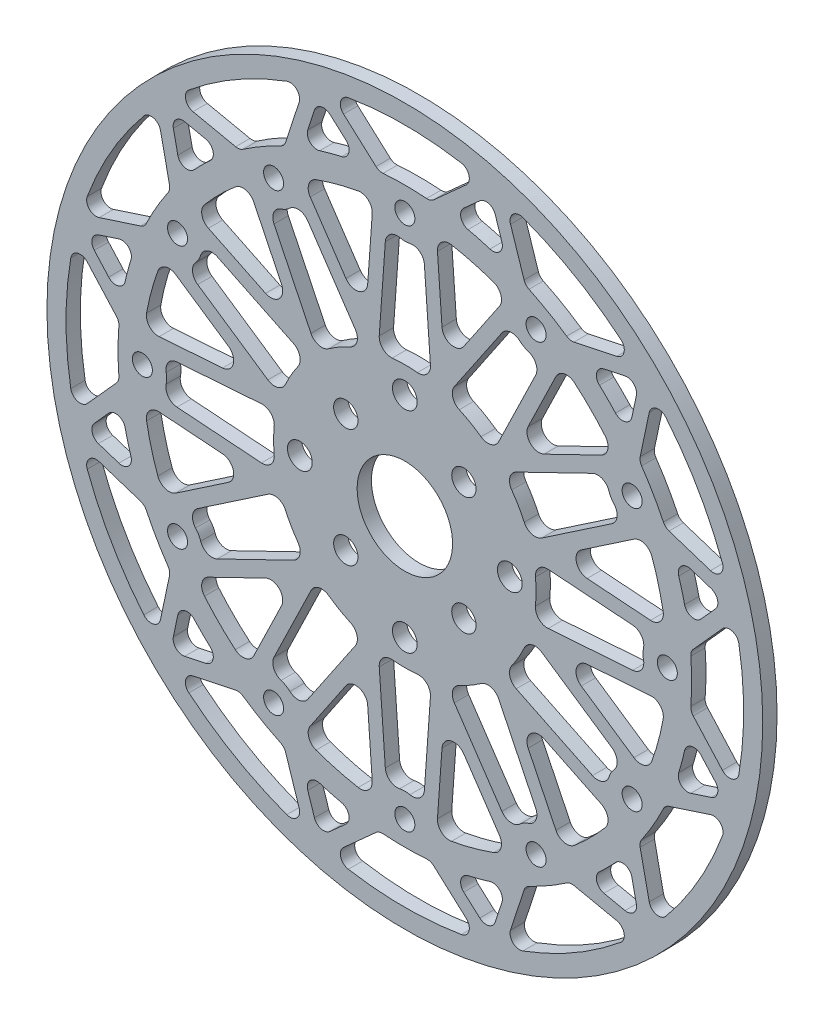
from build123d import *

# Parameters (mm, degrees)
SKETCH_1_R          = 75
EXTRUDE_1_DEPTH     = 3
SKETCH_2_R          = 2.1
SKETCH_2_R_2        = 2.6
SKETCH_2_R_3        = 2.55
SKETCH_2_R_4        = 10
CUT_EXTRUDE_1_DEPTH = 3
SKETCH_3_R          = 27.5
CUT_EXTRUDE_2_DEPTH = 10
EXTRUDE_1_2_DEPTH   = 3
FILLET_1_R          = 2.5
SKETCH_5_R          = 71
CUT_EXTRUDE_3_DEPTH = 3
EXTRUDE_3_DEPTH     = 3
FILLET_2_R          = 2


with BuildPart() as part:
    # 草图1 → Extrude 1 (new body)
    with BuildSketch(Plane.XY):
        Circle(SKETCH_1_R)
    extrude(amount=EXTRUDE_1_DEPTH)

    # 草图2 → 切除-拉伸1 (cut)
    with BuildSketch(Plane(origin=(0, 0, 0), x_dir=(-1, 0, 0), z_dir=(0, 0, -1))):
        with Locations((0, 55)):
            Circle(SKETCH_2_R)
        with Locations((27.5, 47.631397208)):
            Circle(SKETCH_2_R)
        with Locations((47.631397208, 27.5)):
            Circle(SKETCH_2_R)
        with Locations((55, 0)):
            Circle(SKETCH_2_R)
        with Locations((47.631397208, -27.5)):
            Circle(SKETCH_2_R)
        with Locations((27.5, -47.631397208)):
            Circle(SKETCH_2_R)
        with Locations((0, -55)):
            Circle(SKETCH_2_R)
        with Locations((-27.5, -47.631397208)):
            Circle(SKETCH_2_R)
        with Locations((-47.631397208, -27.5)):
            Circle(SKETCH_2_R)
        with Locations((-55, 0)):
            Circle(SKETCH_2_R)
        with Locations((-47.631397208, 27.5)):
            Circle(SKETCH_2_R)
        with Locations((-27.5, 47.631397208)):
            Circle(SKETCH_2_R)
        with Locations((0, 22)):
            Circle(SKETCH_2_R_2)
        with Locations((12.374368671, 12.374368671)):
            Circle(SKETCH_2_R_3)
        with Locations((22, 0)):
            Circle(SKETCH_2_R_2)
        with Locations((12.374368671, -12.374368671)):
            Circle(SKETCH_2_R_3)
        with Locations((0, -22)):
            Circle(SKETCH_2_R_2)
        with Locations((-12.374368671, -12.374368671)):
            Circle(SKETCH_2_R_3)
        with Locations((-22, 0)):
            Circle(SKETCH_2_R_2)
        with Locations((-12.374368671, 12.374368671)):
            Circle(SKETCH_2_R_3)
        Circle(SKETCH_2_R_4)
    extrude(amount=-CUT_EXTRUDE_1_DEPTH, mode=Mode.SUBTRACT)

    # 草图3 → 切除-拉伸2 (cut)
    with BuildSketch(Plane.XY.offset(3)):
        with BuildLine():
            ThreePointArc((5.094515605, 54.763545455), (0, 49.9), (-5.094515605, 54.763545455))
            ThreePointArc((-5.094515605, 54.763545455), (-14.235047481, 53.125920446), (-22.969792794, 49.973879367))
            ThreePointArc((-22.969792794, 49.973879367), (-24.95, 43.214667649), (-31.793752661, 44.879363763))
            ThreePointArc((-31.793752661, 44.879363763), (-38.890872965, 38.890872965), (-44.879363763, 31.793752661))
            ThreePointArc((-44.879363763, 31.793752661), (-43.214667649, 24.95), (-49.973879367, 22.969792794))
            ThreePointArc((-49.973879367, 22.969792794), (-53.125920446, 14.235047481), (-54.763545455, 5.094515605))
            ThreePointArc((-54.763545455, 5.094515605), (-49.9, 0), (-54.763545455, -5.094515605))
            ThreePointArc((-54.763545455, -5.094515605), (-53.125920446, -14.235047481), (-49.973879367, -22.969792794))
            ThreePointArc((-49.973879367, -22.969792794), (-43.214667649, -24.95), (-44.879363763, -31.793752661))
            ThreePointArc((-44.879363763, -31.793752661), (-38.890872965, -38.890872965), (-31.793752661, -44.879363763))
            ThreePointArc((-31.793752661, -44.879363763), (-24.95, -43.214667649), (-22.969792794, -49.973879367))
            ThreePointArc((-22.969792794, -49.973879367), (-14.235047481, -53.125920446), (-5.094515605, -54.763545455))
            ThreePointArc((-5.094515605, -54.763545455), (0, -49.9), (5.094515605, -54.763545455))
            ThreePointArc((5.094515605, -54.763545455), (14.235047481, -53.125920446), (22.969792793, -49.973879367))
            ThreePointArc((22.969792793, -49.973879367), (24.95, -43.214667649), (31.793752661, -44.879363763))
            ThreePointArc((31.793752661, -44.879363763), (38.890872965, -38.890872965), (44.879363763, -31.793752661))
            ThreePointArc((44.879363763, -31.793752661), (43.214667649, -24.95), (49.973879367, -22.969792794))
            ThreePointArc((49.973879367, -22.969792794), (53.125920446, -14.235047481), (54.763545455, -5.094515605))
            ThreePointArc((54.763545455, -5.094515605), (49.9, 0), (54.763545455, 5.094515605))
            ThreePointArc((54.763545455, 5.094515605), (53.125920446, 14.235047481), (49.973879367, 22.969792794))
            ThreePointArc((49.973879367, 22.969792794), (43.214667649, 24.95), (44.879363763, 31.793752661))
            ThreePointArc((44.879363763, 31.793752661), (38.890872965, 38.890872965), (31.793752661, 44.879363763))
            ThreePointArc((31.793752661, 44.879363763), (24.95, 43.214667649), (22.969792794, 49.973879367))
            ThreePointArc((22.969792794, 49.973879367), (14.235047481, 53.125920446), (5.094515605, 54.763545455))
        make_face()
        Circle(SKETCH_3_R, mode=Mode.SUBTRACT)
    extrude(amount=-CUT_EXTRUDE_2_DEPTH, mode=Mode.SUBTRACT)


with BuildPart() as cut_extrude_2_piece_1:
    # of the separate pieces the step leaves, piece 1, a body of its own (cut_extrude_2_pieces)
    add(part.part.solids().sort_by_distance((75, 0, 0))[0])



with BuildPart() as cut_extrude_2_piece_2:
    # of the separate pieces the step leaves, piece 2, a body of its own (cut_extrude_2_pieces)
    add(part.part.solids().sort_by_distance((27.5, 0, 0))[0])


with BuildPart() as cut_extrude_2_piece_1_1:
    add(cut_extrude_2_piece_1.part)

    add(cut_extrude_2_piece_2.part)  # Extrude 1 2 merges 切除-拉伸2 piece 2
    # 草图4 → Extrude 1 2 (add)
    with BuildSketch(Plane.XY.offset(3)):
        Polygon((-6.590670856, 54.870874229), (-8.303787321, 30.990156178), (-21.727748725, 50.814906438), (-24.211836862, 49.132852297), (-5.93126016, 22.135764268), (-3.598360354, 54.65621668), align=None)
        Polygon((3.598360354, 54.65621668), (5.93126016, 22.135764268), (24.211836862, 49.132852297), (21.727748725, 50.814906438), (8.303787321, 30.990156178), (6.590670856, 54.870874229), align=None)
        Polygon((30.444379819, 45.534491943), (16.204504109, 16.204504109), (45.534491943, 30.444379819), (44.224235582, 33.143125503), (22.686368857, 22.686368857), (33.143125503, 44.224235582), align=None)
        Polygon((49.132852297, 24.211836862), (22.135764268, 5.93126016), (54.65621668, 3.598360354), (54.870874229, 6.590670856), (30.990156178, 8.303787321), (50.814906438, 21.727748725), align=None)
        Polygon((54.65621668, -3.598360354), (22.135764268, -5.93126016), (49.132852297, -24.211836862), (50.814906438, -21.727748725), (30.990156178, -8.303787321), (54.870874229, -6.590670856), align=None)
        Polygon((45.534491943, -30.444379819), (16.204504109, -16.204504109), (30.444379819, -45.534491943), (33.143125503, -44.224235582), (22.686368857, -22.686368857), (44.224235582, -33.143125503), align=None)
        Polygon((24.211836862, -49.132852297), (5.93126016, -22.135764268), (3.598360354, -54.65621668), (6.590670856, -54.870874229), (8.303787321, -30.990156178), (21.727748725, -50.814906438), align=None)
        Polygon((-3.598360354, -54.65621668), (-5.93126016, -22.135764268), (-24.211836862, -49.132852297), (-21.727748725, -50.814906438), (-8.303787321, -30.990156178), (-6.590670856, -54.870874229), align=None)
        Polygon((-30.444379819, -45.534491943), (-16.204504109, -16.204504109), (-45.534491943, -30.444379819), (-44.224235582, -33.143125503), (-22.686368857, -22.686368857), (-33.143125503, -44.224235582), align=None)
        Polygon((-49.132852297, -24.211836862), (-22.135764268, -5.93126016), (-54.65621668, -3.598360354), (-54.870874229, -6.590670856), (-30.990156178, -8.303787321), (-50.814906438, -21.727748725), align=None)
        Polygon((-54.65621668, 3.598360354), (-22.135764268, 5.93126016), (-49.132852297, 24.211836862), (-50.814906438, 21.727748725), (-30.990156178, 8.303787321), (-54.870874229, 6.590670856), align=None)
        Polygon((-45.534491943, 30.444379819), (-16.204504109, 16.204504109), (-30.444379819, 45.534491943), (-33.143125503, 44.224235582), (-22.686368857, 22.686368857), (-44.224235582, 33.143125503), align=None)
    extrude(amount=-EXTRUDE_1_2_DEPTH)

    # 圆角1
    fillet_1_edges = [cut_extrude_2_piece_1_1.edges().sort_by_distance(p)[0] for p in [
        (21.576244376, 50.59116206, 1.5),
        (8.303787321, 30.990156178, 1.5),
        (6.610005282, 54.601353739, 1.5),
        (5.58760031, 26.926357399, 1.5),
        (-3.816388015, 51.61692706, 1.5),
        (3.816388015, 51.61692706, 1.5),
        (43.981156778, 33.025109363, 1.5),
        (22.686368857, 22.686368857, 1.5),
        (33.025109363, 43.981156778, 1.5),
        (8.624174885, 26.112709694, 1.5),
        (22.503374558, 46.609764106, 1.5),
        (29.113552501, 42.793376091, 1.5),
        (18.302182514, 20.525109384, 1.5),
        (54.601353739, 6.610005282, 1.5),
        (30.990156178, 8.303787321, 1.5),
        (50.59116206, 21.576244376, 1.5),
        (20.525109384, 18.302182514, 1.5),
        (42.793376091, 29.113552501, 1.5),
        (46.609764106, 22.503374558, 1.5),
        (26.112709694, 8.624174885, 1.5),
        (50.59116206, -21.576244376, 1.5),
        (30.990156178, -8.303787321, 1.5),
        (54.601353739, -6.610005282, 1.5),
        (26.926357399, 5.58760031, 1.5),
        (51.61692706, 3.816388015, 1.5),
        (51.61692706, -3.816388015, 1.5),
        (26.926357399, -5.58760031, 1.5),
        (33.025109363, -43.981156778, 1.5),
        (22.686368857, -22.686368857, 1.5),
        (43.981156778, -33.025109363, 1.5),
        (26.112709694, -8.624174885, 1.5),
        (46.609764106, -22.503374558, 1.5),
        (42.793376091, -29.113552501, 1.5),
        (20.525109384, -18.302182514, 1.5),
        (6.610005282, -54.601353739, 1.5),
        (8.303787321, -30.990156178, 1.5),
        (21.576244376, -50.59116206, 1.5),
        (18.302182514, -20.525109384, 1.5),
        (29.113552501, -42.793376091, 1.5),
        (22.503374558, -46.609764106, 1.5),
        (8.624174885, -26.112709694, 1.5),
        (-21.576244376, -50.59116206, 1.5),
        (-8.303787321, -30.990156178, 1.5),
        (-6.610005282, -54.601353739, 1.5),
        (5.58760031, -26.926357399, 1.5),
        (3.816388015, -51.61692706, 1.5),
        (-3.816388015, -51.61692706, 1.5),
        (-5.58760031, -26.926357399, 1.5),
        (-43.981156778, -33.025109363, 1.5),
        (-22.686368857, -22.686368857, 1.5),
        (-33.025109363, -43.981156778, 1.5),
        (-8.624174885, -26.112709694, 1.5),
        (-22.503374558, -46.609764106, 1.5),
        (-29.113552501, -42.793376091, 1.5),
        (-18.302182514, -20.525109384, 1.5),
        (-54.601353739, -6.610005282, 1.5),
        (-30.990156178, -8.303787321, 1.5),
        (-50.59116206, -21.576244376, 1.5),
        (-20.525109384, -18.302182514, 1.5),
        (-42.793376091, -29.113552501, 1.5),
        (-46.609764106, -22.503374558, 1.5),
        (-26.112709694, -8.624174885, 1.5),
        (-50.59116206, 21.576244376, 1.5),
        (-30.990156178, 8.303787321, 1.5),
        (-54.601353739, 6.610005282, 1.5),
        (-26.926357399, -5.58760031, 1.5),
        (-51.61692706, -3.816388015, 1.5),
        (-51.61692706, 3.816388015, 1.5),
        (-26.926357399, 5.58760031, 1.5),
        (-33.025109363, 43.981156778, 1.5),
        (-22.686368857, 22.686368857, 1.5),
        (-43.981156778, 33.025109363, 1.5),
        (-29.113552501, 42.793376091, 1.5),
        (-22.503374558, 46.609764106, 1.5),
        (-8.624174885, 26.112709694, 1.5),
        (-18.302182514, 20.525109384, 1.5),
        (-26.112709694, 8.624174885, 1.5),
        (-46.609764106, 22.503374558, 1.5),
        (-42.793376091, 29.113552501, 1.5),
        (-20.525109384, 18.302182514, 1.5),
        (-5.58760031, 26.926357399, 1.5),
        (-8.303787321, 30.990156178, 1.5),
        (-21.576244376, 50.59116206, 1.5),
        (-6.610005282, 54.601353739, 1.5),
    ]]
    fillet(fillet_1_edges, radius=FILLET_1_R)

    # 草图5 → 切除-拉伸3 (cut)
    with BuildSketch(Plane.XY.offset(3)):
        Circle(SKETCH_5_R)
        with BuildLine():
            ThreePointArc((-60.1, 1.1e-08), (-58.052142108, 15.555024805), (-52.048126572, 30.050000338))
            ThreePointArc((-52.048126572, 30.050000338), (-42.49711743, 42.497117669), (-30.050000046, 52.048126741))
            ThreePointArc((-30.050000046, 52.048126741), (-15.555024636, 58.052142153), (0, 60.1))
            ThreePointArc((0, 60.1), (15.555024667, 58.052142145), (30.050000102, 52.048126709))
            ThreePointArc((30.050000102, 52.048126709), (42.497117549, 42.497117549), (52.048126709, 30.050000102))
            ThreePointArc((52.048126709, 30.050000102), (58.052142145, 15.555024667), (60.1, 0))
            ThreePointArc((60.1, 0), (58.052142154, -15.555024634), (52.048126743, -30.050000042))
            ThreePointArc((52.048126743, -30.050000042), (42.497116269, -42.497118829), (30.049996907, -52.048128553))
            ThreePointArc((30.049996907, -52.048128553), (15.555022879, -58.052142624), (-1.3e-08, -60.1))
            ThreePointArc((-1.3e-08, -60.1), (-15.555022021, -58.052142854), (-30.049995345, -52.048129455))
            ThreePointArc((-30.049995345, -52.048129455), (-42.497117462, -42.497117637), (-52.048129331, -30.049995559))
            ThreePointArc((-52.048129331, -30.049995559), (-58.052142825, -15.555022129), (-60.1, 1.1e-08))
        make_face(mode=Mode.SUBTRACT)
    extrude(amount=-CUT_EXTRUDE_3_DEPTH, mode=Mode.SUBTRACT)


with BuildPart() as cut_extrude_3_piece_1:
    # of the separate pieces the step leaves, piece 1, a body of its own (cut_extrude_3_pieces)
    add(cut_extrude_2_piece_1_1.part.solids().sort_by_distance((52.048126743, -30.050000042, 0))[0])



with BuildPart() as cut_extrude_3_piece_2:
    # of the separate pieces the step leaves, piece 2, a body of its own (cut_extrude_3_pieces)
    add(cut_extrude_2_piece_1_1.part.solids().sort_by_distance((75, 0, 0))[0])


with BuildPart() as cut_extrude_3_piece_1_1:
    add(cut_extrude_3_piece_1.part)

    add(cut_extrude_3_piece_2.part)  # 拉伸-薄壁3 merges 切除-拉伸3 piece 2
    # 草图7 → 拉伸-薄壁3 (add)
    with BuildSketch(Plane.XY.offset(3)):
        Polygon((-26.849148537, 49.627992403), (-19.411428383, 72.444436972), (-1.561951498, 56.403676429), (-3.567203539, 54.172317145), (-17.987894496, 67.13173618), (-23.996869687, 48.698204599), align=None)
        Polygon((1.561951498, 56.403676429), (19.411428383, 72.444436972), (26.849148537, 49.627992403), (23.996869687, 48.698204599), (17.987894496, 67.13173618), (3.567203539, 54.172317145), align=None)
        Polygon((29.554527891, 48.066040905), (53.033008589, 53.033008589), (48.066040905, 29.554527891), (45.13100106, 30.175447458), (49.143841684, 49.143841684), (30.175447458, 45.13100106), align=None)
        Polygon((49.627992403, 26.849148537), (72.444436972, 19.411428383), (56.403676429, 1.561951498), (54.172317145, 3.567203539), (67.13173618, 17.987894496), (48.698204599, 23.996869687), align=None)
        Polygon((56.403676429, -1.561951498), (72.444436972, -19.411428383), (49.627992403, -26.849148537), (48.698204599, -23.996869687), (67.13173618, -17.987894496), (54.172317145, -3.567203539), align=None)
        Polygon((48.066040905, -29.554527891), (53.033008589, -53.033008589), (29.554527891, -48.066040905), (30.175447458, -45.13100106), (49.143841684, -49.143841684), (45.13100106, -30.175447458), align=None)
        Polygon((26.849148537, -49.627992403), (19.411428383, -72.444436972), (1.561951498, -56.403676429), (3.567203539, -54.172317145), (17.987894496, -67.13173618), (23.996869687, -48.698204599), align=None)
        Polygon((-1.561951498, -56.403676429), (-19.411428383, -72.444436972), (-26.849148537, -49.627992403), (-23.996869687, -48.698204599), (-17.987894496, -67.13173618), (-3.567203539, -54.172317145), align=None)
        Polygon((-29.554527891, -48.066040905), (-53.033008589, -53.033008589), (-48.066040905, -29.554527891), (-45.13100106, -30.175447458), (-49.143841684, -49.143841684), (-30.175447458, -45.13100106), align=None)
        Polygon((-49.627992403, -26.849148537), (-72.444436972, -19.411428383), (-56.403676429, -1.561951498), (-54.172317145, -3.567203539), (-67.13173618, -17.987894496), (-48.698204599, -23.996869687), align=None)
        Polygon((-56.403676429, 1.561951498), (-72.444436972, 19.411428383), (-49.627992403, 26.849148537), (-48.698204599, 23.996869687), (-67.13173618, 17.987894496), (-54.172317145, 3.567203539), align=None)
        Polygon((-48.066040905, 29.554527892), (-53.033008589, 53.033008589), (-29.554527891, 48.066040905), (-30.175447458, 45.13100106), (-49.143841684, 49.143841684), (-45.13100106, 30.175447458), align=None)
    extrude(amount=-EXTRUDE_3_DEPTH)

    # 圆角2
    fillet_2_edges = [cut_extrude_3_piece_1_1.edges().sort_by_distance(p)[0] for p in [
        (-49.143841684, 49.143841684, 1.5),
        (-46.73994146, 37.780787079, 1.5),
        (-37.780787079, 46.73994146, 1.5),
        (-9.349150656, 59.368370215, 1.5),
        (-17.987894496, 67.13173618, 1.5),
        (-21.587583136, 56.089092116, 1.5),
        (-48.306828088, 52.033165962, 1.5),
        (-34.608399805, 49.135207977, 1.5),
        (-25.248138426, 54.539357404, 1.5),
        (-20.908629518, 67.851523282, 1.5),
        (17.987894496, 67.13173618, 1.5),
        (9.349150656, 59.368370215, 1.5),
        (21.587583136, 56.089092116, 1.5),
        (-15.81835732, 69.215457607, 1.5),
        (-5.404149426, 59.856538231, 1.5),
        (5.404149426, 59.856538231, 1.5),
        (15.81835732, 69.215457607, 1.5),
        (49.143841684, 49.143841684, 1.5),
        (37.780787079, 46.73994146, 1.5),
        (46.73994146, 37.780787079, 1.5),
        (20.908629518, 67.851523282, 1.5),
        (25.248138426, 54.539357404, 1.5),
        (34.608399805, 49.135207977, 1.5),
        (48.306828088, 52.033165962, 1.5),
        (67.13173618, 17.987894496, 1.5),
        (56.089092116, 21.587583136, 1.5),
        (59.368370215, 9.349150656, 1.5),
        (52.033165962, 48.306828088, 1.5),
        (49.135207977, 34.608399805, 1.5),
        (54.539357404, 25.248138426, 1.5),
        (67.851523282, 20.908629518, 1.5),
        (67.13173618, -17.987894496, 1.5),
        (59.368370215, -9.349150656, 1.5),
        (56.089092116, -21.587583136, 1.5),
        (69.215457607, 15.81835732, 1.5),
        (59.856538231, 5.404149426, 1.5),
        (59.856538231, -5.404149426, 1.5),
        (69.215457607, -15.81835732, 1.5),
        (49.143841684, -49.143841684, 1.5),
        (46.73994146, -37.780787079, 1.5),
        (37.780787079, -46.73994146, 1.5),
        (67.851523282, -20.908629518, 1.5),
        (54.539357404, -25.248138426, 1.5),
        (49.135207977, -34.608399805, 1.5),
        (52.033165962, -48.306828088, 1.5),
        (17.987894496, -67.13173618, 1.5),
        (21.587583136, -56.089092116, 1.5),
        (9.349150656, -59.368370215, 1.5),
        (48.306828088, -52.033165962, 1.5),
        (34.608399805, -49.135207977, 1.5),
        (25.248138426, -54.539357404, 1.5),
        (20.908629518, -67.851523282, 1.5),
        (-17.987894496, -67.13173618, 1.5),
        (-9.349150656, -59.368370215, 1.5),
        (-21.587583136, -56.089092116, 1.5),
        (15.81835732, -69.215457607, 1.5),
        (5.404149426, -59.856538231, 1.5),
        (-5.404149426, -59.856538231, 1.5),
        (-15.81835732, -69.215457607, 1.5),
        (-49.143841684, -49.143841684, 1.5),
        (-37.780787079, -46.73994146, 1.5),
        (-46.73994146, -37.780787079, 1.5),
        (-20.908629518, -67.851523282, 1.5),
        (-25.248138426, -54.539357404, 1.5),
        (-34.608399805, -49.135207977, 1.5),
        (-48.306828088, -52.033165962, 1.5),
        (-67.13173618, -17.987894496, 1.5),
        (-56.089092116, -21.587583136, 1.5),
        (-59.368370215, -9.349150656, 1.5),
        (-52.033165962, -48.306828088, 1.5),
        (-49.135207977, -34.608399805, 1.5),
        (-54.539357404, -25.248138426, 1.5),
        (-67.851523282, -20.908629518, 1.5),
        (-49.135207977, 34.608399805, 1.5),
        (-67.851523282, 20.908629518, 1.5),
        (-54.539357404, 25.248138426, 1.5),
        (-67.13173618, 17.987894496, 1.5),
        (-59.368370215, 9.349150656, 1.5),
        (-56.089092116, 21.587583136, 1.5),
        (-69.215457607, -15.81835732, 1.5),
        (-59.856538231, -5.404149426, 1.5),
        (-59.856538231, 5.404149426, 1.5),
        (-69.215457607, 15.81835732, 1.5),
        (-52.033165962, 48.306828088, 1.5),
    ]]
    fillet(fillet_2_edges, radius=FILLET_2_R)


solid = cut_extrude_3_piece_1_1.part
